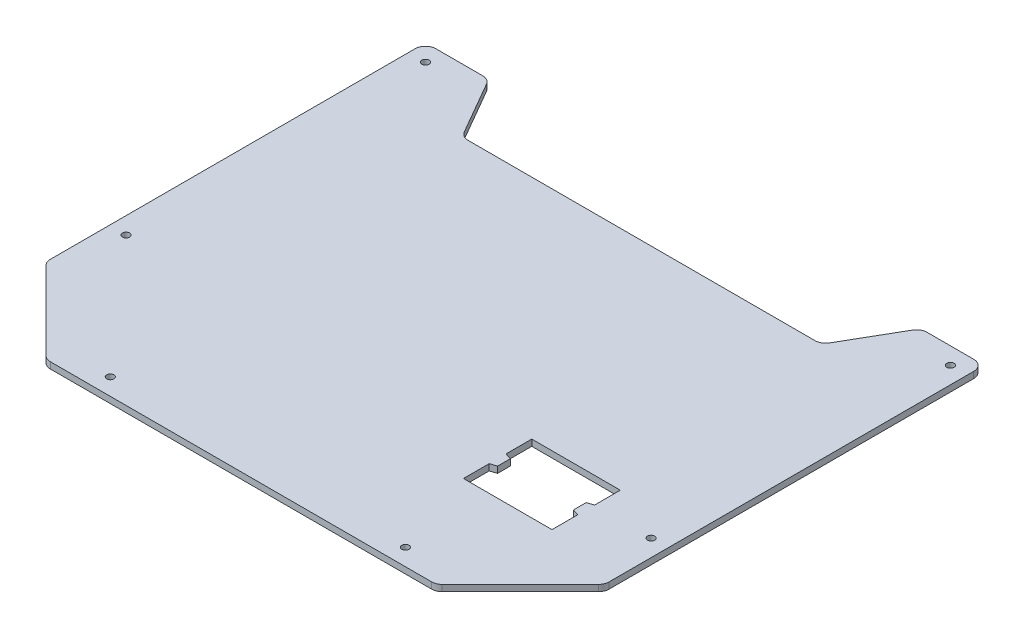
from build123d import *

# Parameters (mm, degrees)
BOSS_EXTRU_1_DEPTH      = 3
CONG_1_R                = 5
ESQUISSE2_R             = 1
ENL_V_MAT_EXTRU_1_DEPTH = 257.837010573
D_GAGEMENT_M31_D        = 3.4
ENL_V_MAT_EXTRU_2_DEPTH = 257.837010573


with BuildPart() as part:
    # Esquisse1 → Boss.-Extru.1 (new body)
    with BuildSketch(Plane(origin=(0, 0, 0), x_dir=(1, 0, 0), z_dir=(0, 1, 0))):
        Polygon((-92.5, 0), (92.5, 0), (132.5, 40), (132.5, 220), (102.5, 220), (85.179491924, 190), (-85.179491924, 190), (-102.5, 220), (-132.5, 220), (-132.5, 40), align=None)
    extrude(amount=BOSS_EXTRU_1_DEPTH)

    # Congé1
    cong_1_edges = [part.edges().sort_by_distance(p)[0] for p in [
        (132.5, 1.5, -220),
        (102.5, 1.5, -220),
        (85.179491924, 1.5, -190),
        (-85.179491924, 1.5, -190),
        (-102.5, 1.5, -220),
        (-132.5, 1.5, -220),
        (-132.5, 1.5, -40),
        (-92.5, 1.5, 0),
        (92.5, 1.5, 0),
        (132.5, 1.5, -40),
    ]]
    fillet(cong_1_edges, radius=CONG_1_R)

    # Esquisse2 → Enlèv. mat.-Extru.1 (cut, through all)
    with BuildSketch(Plane.XZ):
        with Locations((-70, -8)):
            Circle(ESQUISSE2_R)
        with Locations((-124.5, -70)):
            Circle(ESQUISSE2_R)
        with Locations((-124.5, -212)):
            Circle(ESQUISSE2_R)
        with Locations((124.5, -212)):
            Circle(ESQUISSE2_R)
        with Locations((124.5, -70)):
            Circle(ESQUISSE2_R)
        with Locations((70, -8)):
            Circle(ESQUISSE2_R)
    extrude(amount=-ENL_V_MAT_EXTRU_1_DEPTH, mode=Mode.SUBTRACT)

    # Dégagement M31 (through all)
    with Locations(Plane(origin=(0, 0, 0), x_dir=(-1, 0, 0), z_dir=(0, -1, 0))):
        with Locations((-70, 8), (-124.5, 70), (-124.5, 212), (124.5, 212), (124.5, 70), (70, 8)):
            Hole(D_GAGEMENT_M31_D / 2)

    # Esquisse5 → Enlèv. mat.-Extru.2 (cut, through all)
    with BuildSketch(Plane.XZ):
        Polygon((97.5, -50), (55.5, -50), (55.5, -62.2), (58.5, -63.2), (58.5, -69.2), (55.5, -70.2), (55.5, -82.4), (97.5, -82.4), (97.5, -70.2), (94.5, -69.2), (94.5, -63.2), (97.5, -62.2), align=None)
    extrude(amount=-ENL_V_MAT_EXTRU_2_DEPTH, mode=Mode.SUBTRACT)


solid = part.part
